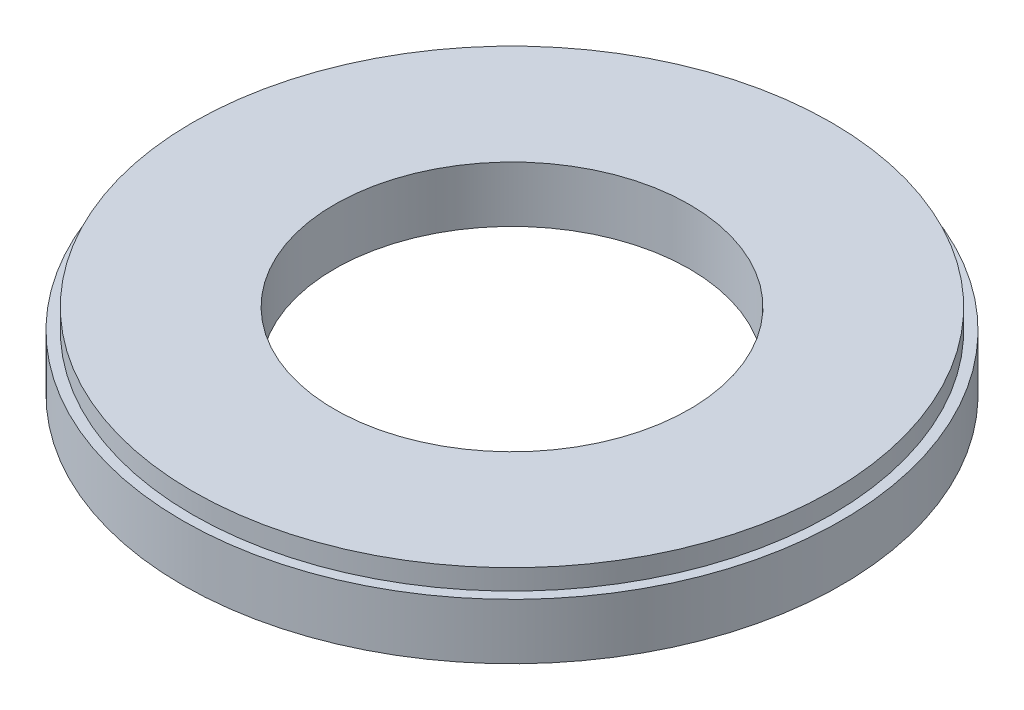
from build123d import *


with BuildPart() as part:
    # Szkic1 → Obrót1 (revolve)
    with BuildSketch(Plane.XY):
        Polygon((-63, 0), (-35, 0), (-35, 11), (-63, 11), (-63, 7), (-65, 7), (-65, -4), (-63, -4), align=None)
    revolve(axis=Axis((0, 0, 0), (0, 1, 0)))


solid = part.part
